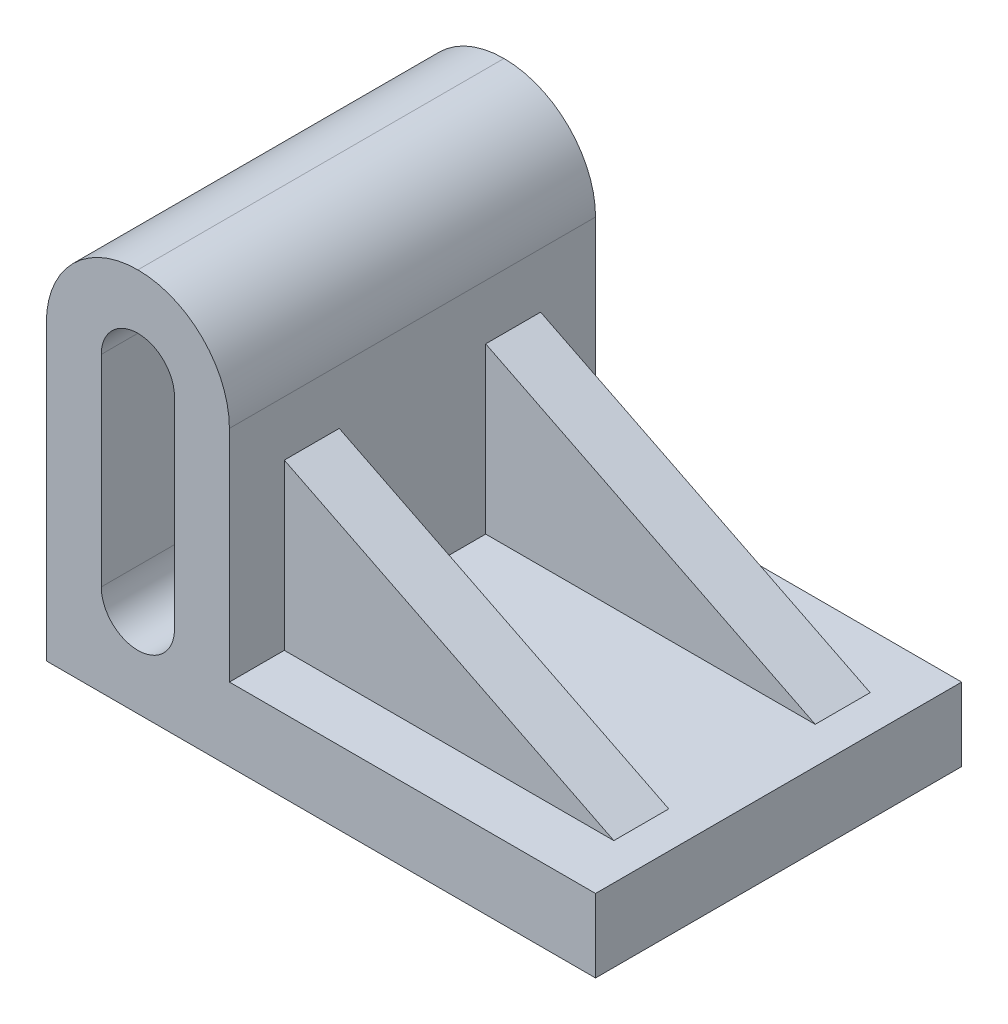
from build123d import *

# Parameters (mm, degrees)
BOSS_EXTRUDE1_DEPTH      = 50
BOSS_EXTRUDE1_DEPTH_BACK = 50
FILLET5_R                = 25
FILLET4_R                = 25
CUT_EXTRUDE1_DEPTH       = 209.62646045
BOSS_EXTRUDE2_START      = 20
BOSS_EXTRUDE2_DEPTH      = 15
BOSS_EXTRUDE3_START      = 40
BOSS_EXTRUDE3_DEPTH      = 15


with BuildPart() as part:
    # Sketch1 → Boss-Extrude1 (new, two sides: drawn at the far end of the back side and taken through both)
    with BuildSketch(Plane.XY.offset(-BOSS_EXTRUDE1_DEPTH_BACK)):
        Polygon((0, 0), (0, 105), (50, 105), (50, 20), (150, 20), (150, 0), align=None)
    extrude(amount=BOSS_EXTRUDE1_DEPTH + BOSS_EXTRUDE1_DEPTH_BACK)

    # Fillet5
    fillet5_edges = [part.edges().sort_by_distance(p)[0] for p in [
        (0, 105, 0),
    ]]
    fillet(fillet5_edges, radius=FILLET5_R)

    # Fillet4
    fillet4_edges = [part.edges().sort_by_distance(p)[0] for p in [
        (50, 105, 0),
    ]]
    fillet(fillet4_edges, radius=FILLET4_R - 0.0001)  # a hair under: the kernel refuses the full size

    # Sketch3 → Cut-Extrude1 (cut, through all)
    with BuildSketch(Plane.XY.offset(50)):
        with BuildLine():
            Line((35, 80), (35, 25))
            ThreePointArc((35, 25), (25, 15), (15, 25))
            Line((15, 25), (15, 80))
            ThreePointArc((15, 80), (25, 90), (35, 80))
        make_face()
    extrude(amount=-CUT_EXTRUDE1_DEPTH, mode=Mode.SUBTRACT)

    # Sketch5 → Boss-Extrude2 (add)
    with BuildSketch(Plane.XY.offset(BOSS_EXTRUDE2_START)):
        Polygon((50, 65), (140, 20), (50, 20), align=None)
    extrude(amount=BOSS_EXTRUDE2_DEPTH)

    # Sketch9 → Boss-Extrude3 (add)
    with BuildSketch(Plane(origin=(0, 0, 20), x_dir=(-1, 0, 0), z_dir=(0, 0, -1)).offset(BOSS_EXTRUDE3_START)):
        Polygon((-50, 20), (-50, 65), (-140, 20), align=None)
    extrude(amount=BOSS_EXTRUDE3_DEPTH)


solid = part.part
